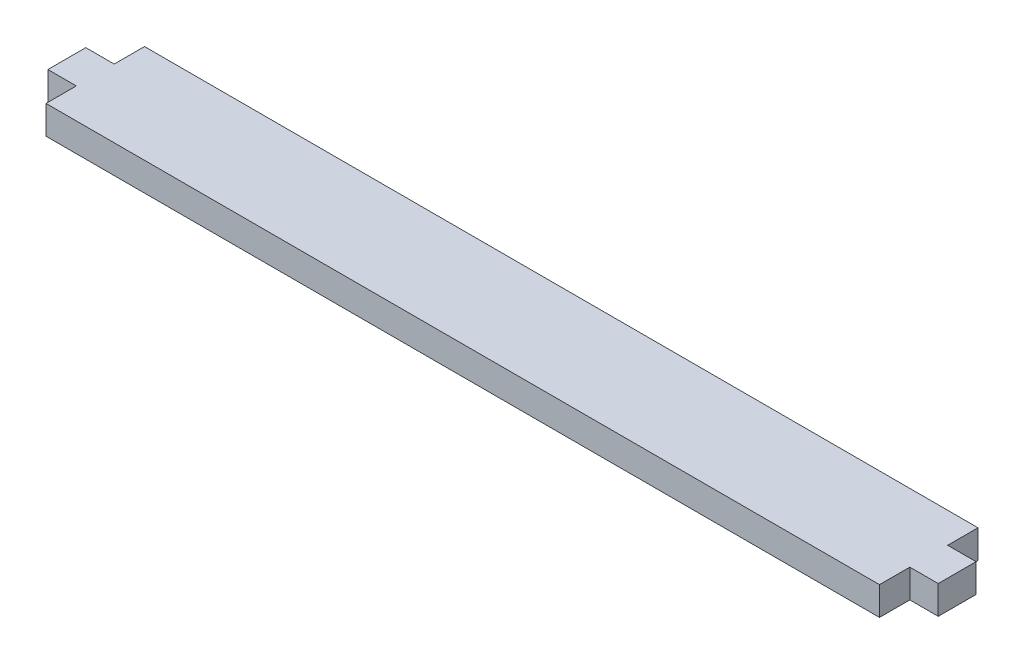
from build123d import *

# Parameters (mm, degrees)
SKETCH1_W           = 279.4
SKETCH1_H           = 33.02
BOSS_EXTRUDE1_DEPTH = 9.525
SKETCH2_W           = 12.7
SKETCH2_H           = 9.525
BOSS_EXTRUDE2_DEPTH = 9.525


with BuildPart() as part:
    # Sketch1 → Boss-Extrude1 (new body)
    with BuildSketch(Plane(origin=(0, 0, 0), x_dir=(1, 0, 0), z_dir=(0, 1, 0))):
        Rectangle(SKETCH1_W, SKETCH1_H)
    extrude(amount=BOSS_EXTRUDE1_DEPTH)

    # Sketch2 → Boss-Extrude2 (add)
    with BuildSketch(Plane(origin=(139.7, 0, 0), x_dir=(0, 0, -1), z_dir=(1, 0, 0))):
        with Locations((0, 4.7625)):
            Rectangle(SKETCH2_W, SKETCH2_H)
    boss_extrude2 = extrude(amount=BOSS_EXTRUDE2_DEPTH)

    # Mirror1: Boss-Extrude2 across plane
    add(boss_extrude2.mirror(Plane(origin=(0, 0, 0), x_dir=(0, 0, 1), z_dir=(1, 0, 0))))


solid = part.part
